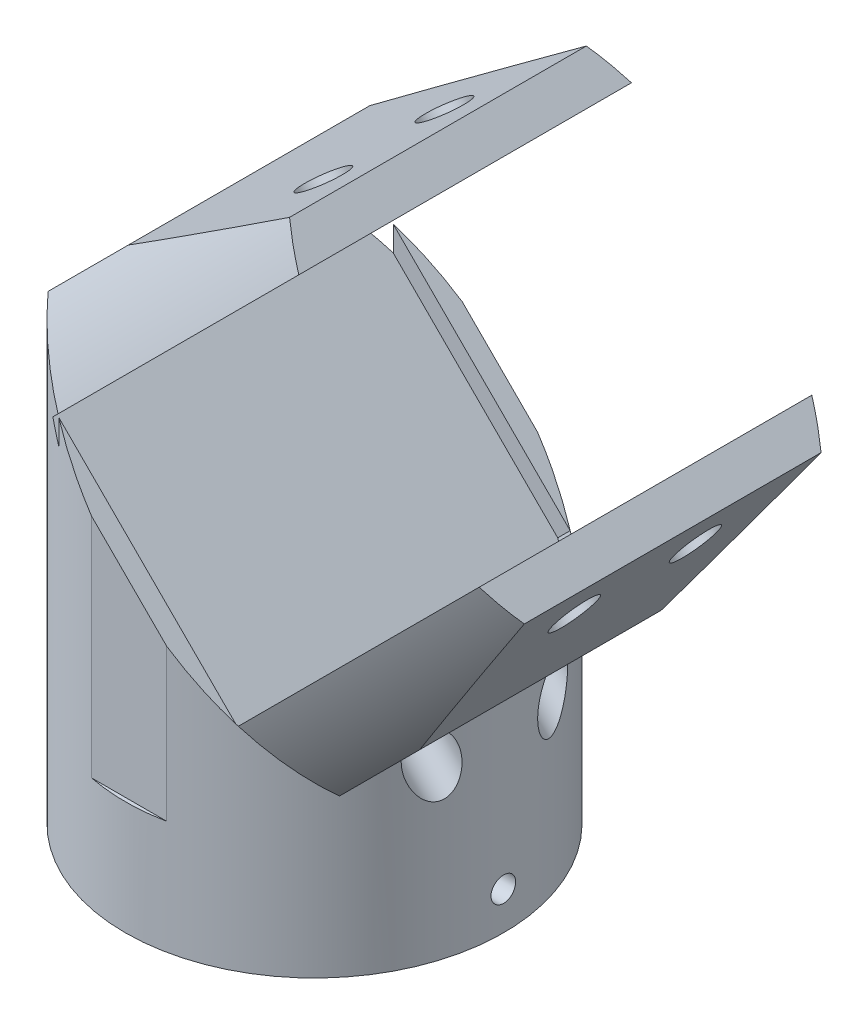
from build123d import *

# Parameters (mm, degrees)
SKETCH1_R               = 25
SKETCH1_R_2             = 20.15
BOSS_EXTRUDE1_DEPTH     = 10
SKETCH2_R               = 25
BOSS_EXTRUDE2_DEPTH     = 5
BOSS_EXTRUDE3_DEPTH     = 50
CUT_EXTRUDE1_DEPTH      = 50
SKETCH5_W               = 44
SKETCH5_H               = 33.5
CUT_EXTRUDE2_DEPTH      = 2.33
SKETCH6_W               = 31.902194282
SKETCH6_H               = 10.372222151
BOSS_EXTRUDE5_DEPTH     = 45
BOSS_EXTRUDE6_DEPTH     = 45
BOSS_EXTRUDE7_DEPTH     = 20
SKETCH10_R              = 1.375
CUT_EXTRUDE3_DEPTH      = 77
SKETCH11_R              = 1.375
CUT_EXTRUDE4_DEPTH      = 77
SKETCH12_R              = 3
CUT_EXTRUDE5_DEPTH      = 7.38
CUT_EXTRUDE6_DEPTH      = 7.88
CUT_EXTRUDE6_DEPTH_BACK = 7.38
SKETCH13_R              = 3
CHAMFER1_SIZE           = 30
CHAMFER1_SIZE_2         = 5.289809421
CUT_EXTRUDE7_DEPTH      = 37
CUT_EXTRUDE7_DEPTH_BACK = 37
SKETCH16_R              = 1.625


with BuildPart() as part:
    # Sketch1 → Boss-Extrude1 (new body)
    with BuildSketch(Plane(origin=(0, 0, 0), x_dir=(1, 0, 0), z_dir=(0, 1, 0))):
        with Locations(Location((0, 0, 0), (0, 0, 270))):
            Circle(SKETCH1_R)
        with Locations(Location((0, 0, 0), (0, 0, 270))):
            Circle(SKETCH1_R_2, mode=Mode.SUBTRACT)
    extrude(amount=BOSS_EXTRUDE1_DEPTH)

    # Sketch2 → Boss-Extrude2 (add)
    with BuildSketch(Plane(origin=(0, 10, 0), x_dir=(1, 0, 0), z_dir=(0, 1, 0))):
        with Locations(Location((0, 0, 0), (0, 0, 270))):
            Circle(SKETCH2_R)
    extrude(amount=BOSS_EXTRUDE2_DEPTH)

    # Sketch3 → Boss-Extrude3 (add)
    with BuildSketch(Plane(origin=(0, 15, 0), x_dir=(1, 0, 0), z_dir=(0, 1, 0))):
        with BuildLine():
            ThreePointArc((4.974937186, -24.5), (12.844564237, -21.448010853), (19.25, -15.951097141))
            Line((19.25, -15.951097141), (19.25, 15.951097141))
            ThreePointArc((19.25, 15.951097141), (12.844564237, 21.448010853), (4.974937186, 24.5))
            Line((4.974937186, 24.5), (-4.974937186, 24.5))
            ThreePointArc((-4.974937186, 24.5), (-12.844564237, 21.448010853), (-19.25, 15.951097141))
            Line((-19.25, 15.951097141), (-19.25, -15.951097141))
            ThreePointArc((-19.25, -15.951097141), (-12.844564237, -21.448010853), (-4.974937186, -24.5))
            Line((-4.974937186, -24.5), (4.974937186, -24.5))
        make_face()
    extrude(amount=BOSS_EXTRUDE3_DEPTH)

    # Sketch4 → Cut-Extrude1 (cut)
    with BuildSketch(Plane.XY.offset(24.5)):
        Polygon((-4.974937186, 44.974937186), (4.974937186, 35.025062814), (4.974937186, 65), (-4.974937186, 65), align=None)
        Polygon((4.974937186, 35.025062814), (25, 15), (25, 65), (4.974937186, 65), align=None)
        Polygon((-19.25, 59.25), (-4.974937186, 44.974937186), (-4.974937186, 65), (-19.25, 65), align=None)
    extrude(amount=-CUT_EXTRUDE1_DEPTH, mode=Mode.SUBTRACT)

    # Sketch5 → Cut-Extrude2 (cut)
    # profile 1 of 2: a face of its own
    with BuildSketch(Plane(origin=(20, 20, 0), x_dir=(0, 0, -1), z_dir=(0.7071067811865485, 0.7071067811865467, 0))):
        with BuildLine():
            Line((21.978674947, 45.132882323), (-21.978674947, 45.132882323))
            add(Edge.make_bspline(
                [(-21.978674947, 45.132882323), (-22.0399199, 44.9730967), (-22.1, 44.81242904)],
                knots=[4.215256564, 4.215256564, 4.215256564, 4.225444941, 4.225444941, 4.225444941], degree=2, weights=[0.971948047, 0.972055152, 0.97218796]))
            Line((-22.1, 44.81242904), (-22.1, 11.756113455))
            add(Edge.make_bspline(
                [(-22.1, 11.756113455), (-22.039397631, 11.594049133), (-21.977610099, 11.432882323)],
                knots=[5.19933302, 5.19933302, 5.19933302, 5.20960995, 5.20960995, 5.20960995], degree=2, weights=[0.97218796, 0.972053998, 0.971946187]))
            Line((-21.977610099, 11.432882323), (21.977610099, 11.432882323))
            add(Edge.make_bspline(
                [(21.977610099, 11.432882323), (22.039397631, 11.594049133), (22.1, 11.756113455)],
                knots=[1.073575357, 1.073575357, 1.073575357, 1.083852287, 1.083852287, 1.083852287], degree=2, weights=[0.971946187, 0.972053998, 0.97218796]))
            Line((22.1, 11.756113455), (22.1, 44.81242904))
            add(Edge.make_bspline(
                [(22.1, 44.81242904), (22.0399199, 44.9730967), (21.978674947, 45.132882323)],
                knots=[2.057740366, 2.057740366, 2.057740366, 2.067928743, 2.067928743, 2.067928743], degree=2, weights=[0.97218796, 0.972055152, 0.971948047]))
        make_face()
        with Locations((0, 28.282882323)):
            Rectangle(SKETCH5_W, SKETCH5_H, mode=Mode.SUBTRACT)
    # profile 2 of 2: a face of its own
    with BuildSketch(Plane(origin=(20, 20, 0), x_dir=(0, 0, -1), z_dir=(0.7071067811865485, 0.7071067811865467, 0))):
        with Locations((0, 28.282882323)):
            Rectangle(SKETCH5_W, SKETCH5_H)
    extrude(amount=-CUT_EXTRUDE2_DEPTH, mode=Mode.SUBTRACT)

    # Sketch6 → Boss-Extrude5 (add)
    with BuildSketch(Plane(origin=(20, 20, 0), x_dir=(0, 0, -1), z_dir=(0.7071067811865487, 0.7071067811865465, 0))):
        with BuildLine():
            Line((-15.951097141, 1.060660172), (-15.951097141, 11.432882323))
            Line((-15.951097141, 11.432882323), (-21.977610099, 11.432882323))
            add(Edge.make_bspline(
                [(-21.977610099, 11.432882323), (-19.67346685, 5.422747233), (-15.951097141, 1.060660172)],
                knots=[5.209205396, 5.209205396, 5.209205396, 5.591230132, 5.591230132, 5.591230132], degree=2, weights=[1, 0.981812537, 1]))
        make_face()
        with Locations((0, 6.246771248)):
            Rectangle(SKETCH6_W, SKETCH6_H)
        with BuildLine():
            Line((21.977610099, 11.432882323), (15.951097141, 11.432882323))
            Line((15.951097141, 11.432882323), (15.951097141, 1.060660172))
            add(Edge.make_bspline(
                [(15.951097141, 1.060660172), (19.67346685, 5.422747233), (21.977610099, 11.432882323)],
                knots=[0.691955175, 0.691955175, 0.691955175, 1.073979912, 1.073979912, 1.073979912], degree=2, weights=[1, 0.981812537, 1]))
        make_face()
    extrude(amount=BOSS_EXTRUDE5_DEPTH)

    # Sketch7 → Boss-Extrude6 (add)
    with BuildSketch(Plane(origin=(20, 20, 0), x_dir=(0, 0, -1), z_dir=(0.7071067811865487, 0.7071067811865465, 0))):
        with BuildLine():
            Line((15.951097141, 55.507882323), (-15.951097141, 55.507882323))
            add(Edge.make_bspline(
                [(-15.951097141, 55.507882323), (-19.67435923, 51.144749519), (-21.978674947, 45.132882323)],
                knots=[3.833547829, 3.833547829, 3.833547829, 4.215661937, 4.215661937, 4.215661937], degree=2, weights=[1, 0.981804052, 1]))
            Line((-21.978674947, 45.132882323), (21.978674947, 45.132882323))
            add(Edge.make_bspline(
                [(21.978674947, 45.132882323), (19.67435923, 51.144749519), (15.951097141, 55.507882323)],
                knots=[2.06752337, 2.06752337, 2.06752337, 2.449637478, 2.449637478, 2.449637478], degree=2, weights=[1, 0.981804052, 1]))
        make_face()
    extrude(amount=BOSS_EXTRUDE6_DEPTH)

    # Sketch8 → Boss-Extrude7 (add)
    with BuildSketch(Plane(origin=(0, 15, 0), x_dir=(1, 0, 0), z_dir=(0, 1, 0))):
        with BuildLine():
            ThreePointArc((25, 0), (23.518609653, 8.477912479), (19.25, 15.951097141))
            Line((19.25, 15.951097141), (19.25, -15.951097141))
            ThreePointArc((19.25, -15.951097141), (23.518609653, -8.477912479), (25, 0))
        make_face()
    extrude(amount=BOSS_EXTRUDE7_DEPTH)

    # Sketch10 → Cut-Extrude3 (cut)
    with BuildSketch(Plane(origin=(-39.25, 39.25, 0), x_dir=(0, 0, 1), z_dir=(-0.7071067811865464, 0.7071067811865487, 0))):
        with Locations(Location((8.001097141, 32.704271247, 0), (0, 0, 270))):
            Circle(SKETCH10_R)
        with Locations(Location((-7.998902859, 32.704271247, 0), (0, 0, 270))):
            Circle(SKETCH10_R)
    extrude(amount=-CUT_EXTRUDE3_DEPTH, mode=Mode.SUBTRACT)

    # Sketch11 → Cut-Extrude4 (cut)
    with BuildSketch(Plane(origin=(-39.25, 39.25, 0), x_dir=(0, 0, 1), z_dir=(-0.7071067811865464, 0.7071067811865487, 0))):
        with Locations(Location((-7.998902859, 64.704271247, 0), (0, 0, 270))):
            Circle(SKETCH11_R)
        with Locations(Location((8.001097141, 64.704271247, 0), (0, 0, 270))):
            Circle(SKETCH11_R)
    extrude(amount=-CUT_EXTRUDE4_DEPTH, mode=Mode.SUBTRACT)

    # Sketch12 → Cut-Extrude5 (cut)
    with BuildSketch(Plane(origin=(-39.25, 39.25, 0), x_dir=(0, 0, 1), z_dir=(-0.7071067811865464, 0.7071067811865487, 0))):
        with Locations(Location((-7.998902859, 64.704271247, 0), (0, 0, 270))):
            Circle(SKETCH12_R)
        with Locations(Location((8.001097141, 64.704271247, 0), (0, 0, 270))):
            Circle(SKETCH12_R)
        with Locations(Location((-7.998902859, 32.704271247, 0), (0, 0, 270))):
            Circle(SKETCH12_R)
        with Locations(Location((8.001097141, 32.704271247, 0), (0, 0, 270))):
            Circle(SKETCH12_R)
    extrude(amount=-CUT_EXTRUDE5_DEPTH, mode=Mode.SUBTRACT)

    # Sketch13 → Cut-Extrude6 (cut, two sides: drawn at the far end of the back side and taken through both)
    with BuildSketch(Plane(origin=(-0.75, 0.75, 0), x_dir=(0, 0, -1), z_dir=(0.7071067811865464, -0.7071067811865487, 0)).offset(-CUT_EXTRUDE6_DEPTH_BACK)):
        with Locations(Location((-8.001097141, 64.704271247, 0), (0, 0, 270))):
            Circle(SKETCH13_R)
        with Locations(Location((7.998902859, 64.704271247, 0), (0, 0, 270))):
            Circle(SKETCH13_R)
        with Locations(Location((-8.001097141, 32.704271247, 0), (0, 0, 270))):
            Circle(SKETCH13_R)
        with Locations(Location((7.998902859, 32.704271247, 0), (0, 0, 270))):
            Circle(SKETCH13_R)
    extrude(amount=CUT_EXTRUDE6_DEPTH + CUT_EXTRUDE6_DEPTH_BACK, mode=Mode.SUBTRACT)

    # Chamfer1
    # the kernel refuses this chamfer: 30, 5.289809421 mm, written as the material it takes off along each edge
    with BuildSketch(Plane(origin=(51.069805153, 52.569805153, 93.907261034), x_dir=(-0.7023657291994666, -0.7118162560985113, 0), z_dir=(0, 0, -1)), Plane(origin=(12.569805153, 91.069805153, -93.907261034), x_dir=(-0.7118162560985133, -0.7023657291994647, 0), z_dir=(0, 0, 1))) as chamfer1_piece_1:
        Polygon((CHAMFER1_SIZE * 0.999977671636, CHAMFER1_SIZE * 0.0066825316561), (-CHAMFER1_SIZE_2 * 0.00668253165642, CHAMFER1_SIZE_2 * 0.999977671684), (0, 0), align=None)
    extrude(amount=187.814522067, mode=Mode.SUBTRACT)

    # Sketch16 → Cut-Extrude7 (cut, two sides: drawn at the far end of the back side and taken through both)
    with BuildSketch(Plane(origin=(0, 0, 0), x_dir=(0, 0, -1), z_dir=(1, 0, 0)).offset(-CUT_EXTRUDE7_DEPTH_BACK)):
        with Locations(Location((0, 5, 0), (0, 0, 180))):
            Circle(SKETCH16_R)
    extrude(amount=CUT_EXTRUDE7_DEPTH + CUT_EXTRUDE7_DEPTH_BACK, mode=Mode.SUBTRACT)


solid = part.part
